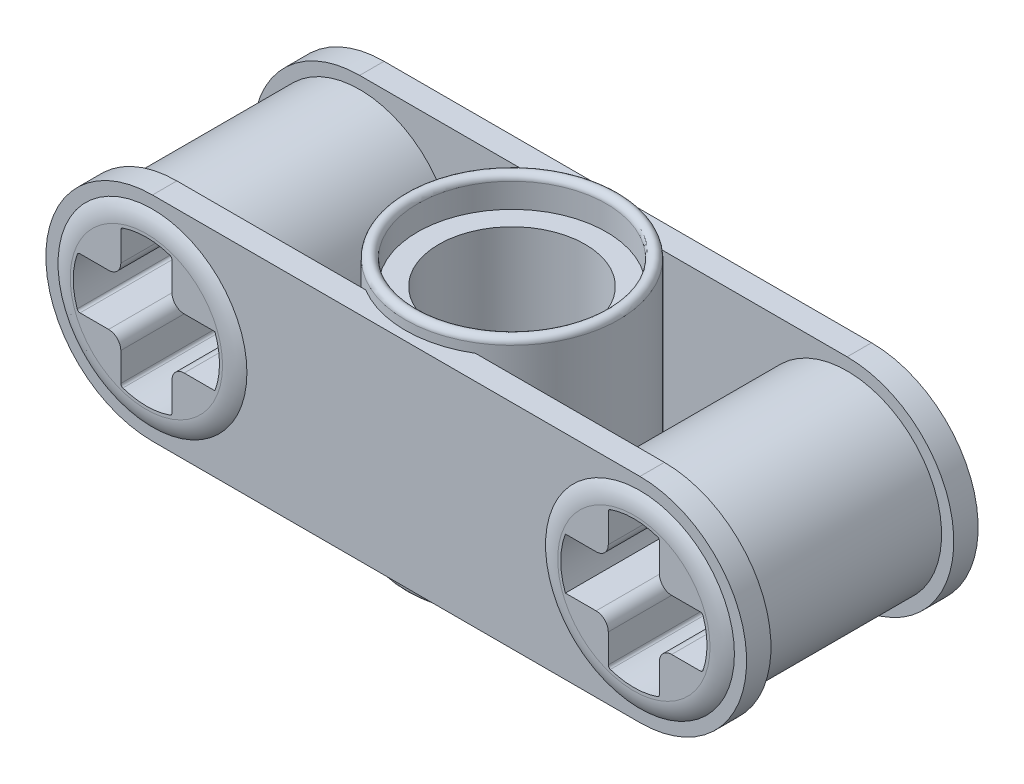
from build123d import *

# Parameters (mm, degrees)
SKETCH1_R           = 3.1
BOSS_EXTRUDE1_DEPTH = 4
BOSS_EXTRUDE2_START = 0.8
SKETCH2_R           = 3.1
BOSS_EXTRUDE2_DEPTH = 0.8
FILLET2_R           = 1
FILLET3_R           = 1
FILLET7_R           = 1
FILLET8_R           = 1
SKETCH4_R           = 3.5
SKETCH4_R_2         = 2.4
BOSS_EXTRUDE3_DEPTH = 4
SKETCH6_R           = 3.1
CUT_EXTRUDE1_DEPTH  = 1
FILLET10_R          = 0.2
FILLET11_R          = 0.2


# Some blends are built 0.0001 mm under size
with BuildPart() as part:
    # Sketch1 → Boss-Extrude1 (new, symmetric)
    # profile 1 of 10: a face of its own
    with BuildSketch(Plane.XY):
        with Locations((8, 0)):
            Circle(SKETCH1_R)
        with BuildLine():
            ThreePointArc((7.227826087, 2.27238805), (8, 2.4), (8.772173913, 2.27238805))
            ThreePointArc((8.772173913, 2.27238805), (9.697056275, 1.697056275), (10.27238805, 0.772173913))
            ThreePointArc((10.27238805, 0.772173913), (10.367882104, 0.391323831), (10.4, 0))
            ThreePointArc((10.4, 0), (10.367882104, -0.391323831), (10.27238805, -0.772173913))
            ThreePointArc((10.27238805, -0.772173913), (9.697056275, -1.697056275), (8.772173913, -2.27238805))
            ThreePointArc((8.772173913, -2.27238805), (8, -2.4), (7.227826087, -2.27238805))
            ThreePointArc((7.227826087, -2.27238805), (6.328594174, -1.722324755), (5.751800721, -0.84))
            ThreePointArc((5.751800721, -0.84), (5.6, 0), (5.751800721, 0.84))
            ThreePointArc((5.751800721, 0.84), (6.328594174, 1.722324755), (7.227826087, 2.27238805))
        make_face(mode=Mode.SUBTRACT)
    # profile 2 of 10: a face of its own
    with BuildSketch(Plane.XY):
        with BuildLine():
            Line((8.84, 2.177705214), (8.84, 1.24))
            ThreePointArc((8.84, 1.24), (8.957157288, 0.957157288), (9.24, 0.84))
            Line((9.24, 0.84), (10.177705214, 0.84))
            ThreePointArc((10.177705214, 0.84), (10.235940121, 0.821293884), (10.27238805, 0.772173913))
            ThreePointArc((10.27238805, 0.772173913), (9.697056275, 1.697056275), (8.772173913, 2.27238805))
            ThreePointArc((8.772173913, 2.27238805), (8.821293884, 2.235940121), (8.84, 2.177705214))
        make_face()
    # profile 3 of 10: a face of its own
    with BuildSketch(Plane.XY):
        with BuildLine():
            ThreePointArc((7.16, 2.177705214), (7.178706116, 2.235940121), (7.227826087, 2.27238805))
            ThreePointArc((7.227826087, 2.27238805), (6.328594174, 1.722324755), (5.751800721, 0.84))
            Line((5.751800721, 0.84), (6.76, 0.84))
            ThreePointArc((6.76, 0.84), (7.042842712, 0.957157288), (7.16, 1.24))
            Line((7.16, 1.24), (7.16, 2.177705214))
        make_face()
    # profile 4 of 10: a face of its own
    with BuildSketch(Plane.XY):
        with BuildLine():
            ThreePointArc((8.772173913, -2.27238805), (9.697056275, -1.697056275), (10.27238805, -0.772173913))
            ThreePointArc((10.27238805, -0.772173913), (10.235940121, -0.821293884), (10.177705214, -0.84))
            Line((10.177705214, -0.84), (9.24, -0.84))
            ThreePointArc((9.24, -0.84), (8.957157288, -0.957157288), (8.84, -1.24))
            Line((8.84, -1.24), (8.84, -2.177705214))
            ThreePointArc((8.84, -2.177705214), (8.821293884, -2.235940121), (8.772173913, -2.27238805))
        make_face()
    # profile 5 of 10: a face of its own
    with BuildSketch(Plane.XY):
        with BuildLine():
            Line((6.76, -0.84), (5.751800721, -0.84))
            ThreePointArc((5.751800721, -0.84), (6.328594174, -1.722324755), (7.227826087, -2.27238805))
            ThreePointArc((7.227826087, -2.27238805), (7.178706116, -2.235940121), (7.16, -2.177705214))
            Line((7.16, -2.177705214), (7.16, -1.24))
            ThreePointArc((7.16, -1.24), (7.042842712, -0.957157288), (6.76, -0.84))
        make_face()
    # profile 6 of 10: a face of its own
    with BuildSketch(Plane.XY):
        with Locations((-8, 0)):
            Circle(SKETCH1_R)
        with BuildLine():
            ThreePointArc((-10.27238805, -0.772173913), (-10.4, 0), (-10.27238805, 0.772173913))
            ThreePointArc((-10.27238805, 0.772173913), (-9.697056275, 1.697056275), (-8.772173913, 2.27238805))
            ThreePointArc((-8.772173913, 2.27238805), (-8, 2.4), (-7.227826087, 2.27238805))
            ThreePointArc((-7.227826087, 2.27238805), (-6.328594174, 1.722324755), (-5.751800721, 0.84))
            ThreePointArc((-5.751800721, 0.84), (-5.638255066, 0.426803075), (-5.6, 0))
            ThreePointArc((-5.6, 0), (-5.638255066, -0.426803075), (-5.751800721, -0.84))
            ThreePointArc((-5.751800721, -0.84), (-6.328594174, -1.722324755), (-7.227826087, -2.27238805))
            ThreePointArc((-7.227826087, -2.27238805), (-8, -2.4), (-8.772173913, -2.27238805))
            ThreePointArc((-8.772173913, -2.27238805), (-9.697056275, -1.697056275), (-10.27238805, -0.772173913))
        make_face(mode=Mode.SUBTRACT)
    # profile 7 of 10: a face of its own
    with BuildSketch(Plane.XY):
        with BuildLine():
            ThreePointArc((-5.751800721, 0.84), (-6.328594174, 1.722324755), (-7.227826087, 2.27238805))
            ThreePointArc((-7.227826087, 2.27238805), (-7.178706116, 2.235940121), (-7.16, 2.177705214))
            Line((-7.16, 2.177705214), (-7.16, 1.24))
            ThreePointArc((-7.16, 1.24), (-7.042842712, 0.957157288), (-6.76, 0.84))
            Line((-6.76, 0.84), (-5.751800721, 0.84))
        make_face()
    # profile 8 of 10: a face of its own
    with BuildSketch(Plane.XY):
        with BuildLine():
            ThreePointArc((-7.16, -2.177705214), (-7.178706116, -2.235940121), (-7.227826087, -2.27238805))
            ThreePointArc((-7.227826087, -2.27238805), (-6.328594174, -1.722324755), (-5.751800721, -0.84))
            Line((-5.751800721, -0.84), (-6.76, -0.84))
            ThreePointArc((-6.76, -0.84), (-7.042842712, -0.957157288), (-7.16, -1.24))
            Line((-7.16, -1.24), (-7.16, -2.177705214))
        make_face()
    # profile 9 of 10: a face of its own
    with BuildSketch(Plane.XY):
        with BuildLine():
            ThreePointArc((-10.177705214, -0.84), (-10.235940121, -0.821293884), (-10.27238805, -0.772173913))
            ThreePointArc((-10.27238805, -0.772173913), (-9.697056275, -1.697056275), (-8.772173913, -2.27238805))
            ThreePointArc((-8.772173913, -2.27238805), (-8.821293884, -2.235940121), (-8.84, -2.177705214))
            Line((-8.84, -2.177705214), (-8.84, -1.24))
            ThreePointArc((-8.84, -1.24), (-8.957157288, -0.957157288), (-9.24, -0.84))
            Line((-9.24, -0.84), (-10.177705214, -0.84))
        make_face()
    # profile 10 of 10: a face of its own
    with BuildSketch(Plane.XY):
        with BuildLine():
            Line((-10.177705214, 0.84), (-9.24, 0.84))
            ThreePointArc((-9.24, 0.84), (-8.957157288, 0.957157288), (-8.84, 1.24))
            Line((-8.84, 1.24), (-8.84, 2.177705214))
            ThreePointArc((-8.84, 2.177705214), (-8.821293884, 2.235940121), (-8.772173913, 2.27238805))
            ThreePointArc((-8.772173913, 2.27238805), (-9.697056275, 1.697056275), (-10.27238805, 0.772173913))
            ThreePointArc((-10.27238805, 0.772173913), (-10.235940121, 0.821293884), (-10.177705214, 0.84))
        make_face()
    extrude(amount=BOSS_EXTRUDE1_DEPTH, both=True)

    # Sketch2 → Boss-Extrude2 (add)
    with BuildSketch(Plane.XY.offset(3).offset(BOSS_EXTRUDE2_START)):
        with BuildLine():
            Line((-8, 3.5), (8, 3.5))
            ThreePointArc((8, 3.5), (11.5, 0), (8, -3.5))
            Line((8, -3.5), (-8, -3.5))
            ThreePointArc((-8, -3.5), (-11.5, 0), (-8, 3.5))
        make_face()
        with Locations((-8, 0)):
            Circle(SKETCH2_R, mode=Mode.SUBTRACT)
        with Locations((8, 0)):
            Circle(SKETCH2_R, mode=Mode.SUBTRACT)
    boss_extrude2 = extrude(amount=-BOSS_EXTRUDE2_DEPTH)

    # Fillet2
    # the kernel refuses this fillet: 1 mm, written as the material it takes off along each edge
    with BuildSketch(Plane(origin=(-8, 0, 4), x_dir=(1, 0, 0), z_dir=(0, -1, 0))) as fillet2_piece_1:
        with BuildLine():
            CenterArc((2.5, -1), FILLET2_R, 53.130102354, 36.869897646)
            Line((3.1, -0.2), (3.1, 0))
            Line((3.1, 0), (2.5, 0))
        make_face()
    revolve(axis=Axis((-8, 0, 4), (0, 0, 1)), mode=Mode.SUBTRACT)

    # Fillet3
    # the kernel refuses this fillet: 1 mm, written as the material it takes off along each edge
    with BuildSketch(Plane(origin=(8, 0, 4), x_dir=(1, 0, 0), z_dir=(0, -1, 0))) as fillet3_piece_1:
        with BuildLine():
            CenterArc((2.5, -1), FILLET3_R, 53.130102354, 36.869897646)
            Line((2.5, 0), (2.5, 0.02))
            Line((2.5, 0.02), (3.1, 0.02))
            Line((3.1, 0.02), (3.12, 0))
            ThreePointArc((3.12, 0), (3.12, -0.1), (3.112, -0.184))
            Line((3.112, -0.184), (3.1, -0.2))
        make_face()
    revolve(axis=Axis((8, 0, 4), (0, 0, 1)), mode=Mode.SUBTRACT)

    # Mirror2: Boss-Extrude2 across plane
    add(boss_extrude2.mirror(Plane.XY))

    # Fillet7
    # the kernel refuses this fillet: 1 mm, written as the material it takes off along each edge
    with BuildSketch(Plane(origin=(8, 0, -4), x_dir=(1, 0, 0), z_dir=(0, -1, 0))) as fillet7_piece_1:
        with BuildLine():
            CenterArc((2.5, 1), FILLET7_R, 270, 36.869897646)
            Line((2.5, 0), (2.5, -0.02))
            Line((2.5, -0.02), (3.1, -0.02))
            Line((3.1, -0.02), (3.12, 0))
            ThreePointArc((3.12, 0), (3.12, 0.1), (3.112, 0.184))
            Line((3.112, 0.184), (3.1, 0.2))
        make_face()
    revolve(axis=Axis((8, 0, -4), (0, 0, 1)), mode=Mode.SUBTRACT)

    # Fillet8
    # the kernel refuses this fillet: 1 mm, written as the material it takes off along each edge
    with BuildSketch(Plane(origin=(-8, 0, -4), x_dir=(1, 0, 0), z_dir=(0, -1, 0))) as fillet8_piece_1:
        with BuildLine():
            CenterArc((2.5, 1), FILLET8_R, 270, 36.869897646)
            Line((2.5, 0), (2.5, -0.02))
            Line((2.5, -0.02), (3.1, -0.02))
            Line((3.1, -0.02), (3.12, 0))
            ThreePointArc((3.12, 0), (3.12, 0.1), (3.112, 0.184))
            Line((3.112, 0.184), (3.1, 0.2))
        make_face()
    revolve(axis=Axis((-8, 0, -4), (0, 0, 1)), mode=Mode.SUBTRACT)

    # Sketch4 → Boss-Extrude3 (add, symmetric)
    with BuildSketch(Plane(origin=(0, 0, 0), x_dir=(1, 0, 0), z_dir=(0, 1, 0))):
        with Locations(Location((0, 0, 0), (0, 0, 270))):
            Circle(SKETCH4_R)
        with Locations(Location((0, 0, 0), (0, 0, 270))):
            Circle(SKETCH4_R_2, mode=Mode.SUBTRACT)
    extrude(amount=BOSS_EXTRUDE3_DEPTH, both=True)

    # Sketch6 → Cut-Extrude1 (cut)
    with BuildSketch(Plane(origin=(0, 4, 0), x_dir=(1, 0, 0), z_dir=(0, 1, 0))):
        with Locations(Location((0, 0, 0), (0, 0, 270))):
            Circle(SKETCH6_R)
    cut_extrude1 = extrude(amount=-CUT_EXTRUDE1_DEPTH, mode=Mode.SUBTRACT)

    # Mirror5: Cut-Extrude1 across plane
    add(cut_extrude1.mirror(Plane.ZX), mode=Mode.SUBTRACT)

    # Fillet10
    fillet10_edges = [part.edges().sort_by_distance(p)[0] for p in [
        (0, 4, -3.5),
        (0, 4, -3.1),
    ]]
    fillet(fillet10_edges, radius=FILLET10_R - 0.0001)  # a hair under: the kernel refuses the full size

    # Fillet11
    fillet11_edges = [part.edges().sort_by_distance(p)[0] for p in [
        (0, -4, -3.5),
        (0, -4, -3.1),
    ]]
    fillet(fillet11_edges, radius=FILLET11_R - 0.0001)  # a hair under: the kernel refuses the full size


solid = part.part
